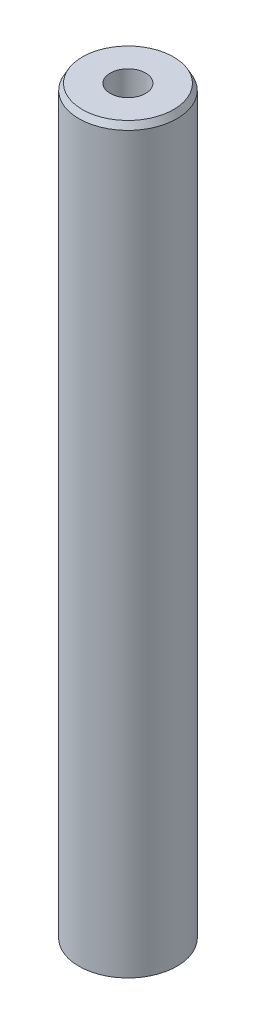
from build123d import *
from OCP.BRepFilletAPI import BRepFilletAPI_MakeChamfer

# Parameters (mm, degrees)
SKETCH1_R           = 5
BOSS_EXTRUDE1_DEPTH = 75.828726097
SKETCH2_R           = 1.803988858
CUT_EXTRUDE1_DEPTH  = 77.157702838
CHAMFER1_SIZE       = 0.630573209
CHAMFER1_SIZE2      = 0.349005221


with BuildPart() as part:
    # Sketch1 → Boss-Extrude1 (new body)
    with BuildSketch(Plane(origin=(0, 0, 0), x_dir=(1, 0, 0), z_dir=(0, 1, 0))):
        Circle(SKETCH1_R)
    extrude(amount=BOSS_EXTRUDE1_DEPTH)

    # Sketch2 → Cut-Extrude1 (cut, through all)
    with BuildSketch(Plane(origin=(0, 0, 0), x_dir=(1, 0, 0), z_dir=(0, 1, 0))):
        Circle(SKETCH2_R)
    extrude(amount=CUT_EXTRUDE1_DEPTH, mode=Mode.SUBTRACT)

    # Chamfer1: one chamfer whose edges measure the first distance from different faces: ONE call of the kernel's chamfer builder (chamfer() names one face for all edges)
    chamfer1_edges_1 = [part.edges().sort_by_distance(p)[0] for p in [
        (-5, 75.828726097, 0),
    ]]
    chamfer1_side_1 = [part.faces().sort_by_distance(p)[0] for p in [
        (-5, 37.914363049, 0),
    ]]
    chamfer1_edges_2 = [part.edges().sort_by_distance(p)[0] for p in [
        (-5, 0, 0),
    ]]
    chamfer1_side_2 = [part.faces().sort_by_distance(p)[0] for p in [
        (-4.858578644, 0, 0),
    ]]
    chamfer1 = BRepFilletAPI_MakeChamfer(part.part.solid().wrapped)
    for e in chamfer1_edges_1:
        chamfer1.Add(CHAMFER1_SIZE, CHAMFER1_SIZE2, e.wrapped, chamfer1_side_1[0].wrapped)  # the first distance lies on this face
    for e in chamfer1_edges_2:
        chamfer1.Add(CHAMFER1_SIZE, CHAMFER1_SIZE2, e.wrapped, chamfer1_side_2[0].wrapped)  # the first distance lies on this face
    add(Compound.cast(chamfer1.Shape()), mode=Mode.REPLACE)


solid = part.part
